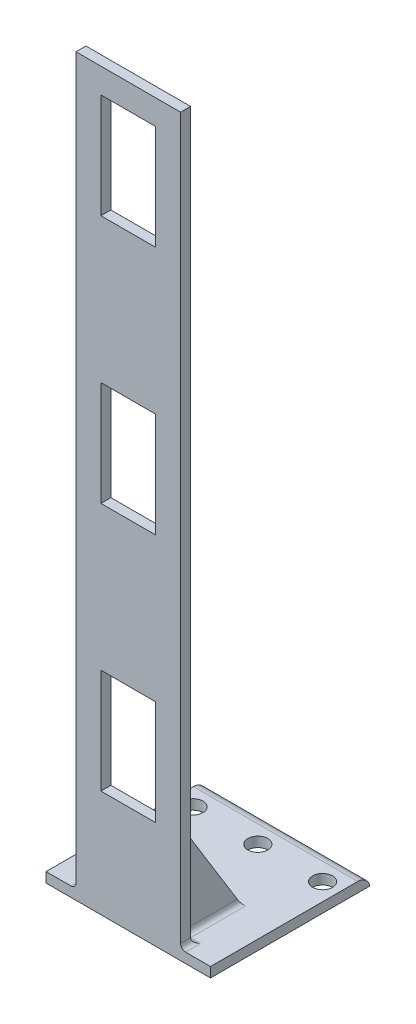
from build123d import *

# Parameters (mm, degrees)
SKETCH1_W                = 21
SKETCH1_H                = 145.5
SKETCH1_W_2              = 11
SKETCH1_H_2              = 21
BOSS_EXTRUDE1_DEPTH      = 2
BOSS_EXTRUDE2_DEPTH      = 30
BOSS_EXTRUDE2_DEPTH_BACK = 2
FILLET2_R                = 2.5
SKETCH6_R                = 2
CUT_EXTRUDE1_DEPTH       = 2
BOSS_EXTRUDE5_DEPTH      = 1
BOSS_EXTRUDE6_DEPTH      = 1
SKETCH9_R                = 2
CUT_EXTRUDE2_DEPTH       = 2
FILLET3_R                = 1


with BuildPart() as part:
    # Sketch1 → Boss-Extrude1 (new body)
    with BuildSketch(Plane.XY):
        Rectangle(SKETCH1_W, SKETCH1_H)
        with Locations((0, -42.75)):
            Rectangle(SKETCH1_W_2, SKETCH1_H_2, mode=Mode.SUBTRACT)
        with Locations((0, 7.25)):
            Rectangle(SKETCH1_W_2, SKETCH1_H_2, mode=Mode.SUBTRACT)
        with Locations((0, 57.25)):
            Rectangle(SKETCH1_W_2, SKETCH1_H_2, mode=Mode.SUBTRACT)
    extrude(amount=BOSS_EXTRUDE1_DEPTH)

    # Sketch2 → Boss-Extrude2 (add, two sides: drawn at the far end of the back side and taken through both)
    with BuildSketch(Plane(origin=(0, 0, 0), x_dir=(-1, 0, 0), z_dir=(0, 0, -1)).offset(-BOSS_EXTRUDE2_DEPTH_BACK)):
        Polygon((10.5, -72.75), (16.5, -72.75), (16.5, -74.75), (-16.5, -74.75), (-16.5, -72.75), align=None)
    extrude(amount=BOSS_EXTRUDE2_DEPTH + BOSS_EXTRUDE2_DEPTH_BACK)

    # Fillet2
    # the kernel refuses this fillet: 2.5 mm, written as the material it takes off along each edge
    with BuildSketch(Plane(origin=(22.623724357, -72.75, -30), x_dir=(0, 0, 1), z_dir=(-1, 0, 0))) as fillet2_piece_1:
        with BuildLine():
            CenterArc((2.449489743, -2.5), FILLET2_R, 90, 78.463040967)
            Line((0, -2), (-0.048989795, -1.99))
            ThreePointArc((-0.048989795, -1.99), (-0.05, -1), (-0.05, 0))
            Line((-0.05, 0), (0, 0.05))
            Line((0, 0.05), (2.449489743, 0.05))
            Line((2.449489743, 0.05), (2.449489743, 0))
        make_face()
    extrude(amount=45.247448714, mode=Mode.SUBTRACT)

    # Sketch6 → Cut-Extrude1 (cut)
    with BuildSketch(Plane(origin=(0, -72.75, 0), x_dir=(1, 0, 0), z_dir=(0, 1, 0))):
        with Locations(Location((0, 24, 0), (0, 0, 270))):
            Circle(SKETCH6_R)
    extrude(amount=-CUT_EXTRUDE1_DEPTH, mode=Mode.SUBTRACT)

    # Sketch7 → Boss-Extrude5 (add, symmetric)
    with BuildSketch(Plane(origin=(7.5, 0, 0), x_dir=(0, 0, -1), z_dir=(1, 0, 0))):
        Polygon((0, -53.25), (12, -72.75), (0, -72.75), align=None)
    extrude(amount=BOSS_EXTRUDE5_DEPTH, both=True)

    # Sketch8 → Boss-Extrude6 (add, symmetric)
    with BuildSketch(Plane(origin=(-7.5, 0, 0), x_dir=(0, 0, -1), z_dir=(1, 0, 0))):
        Polygon((12, -72.75), (0, -53.25), (0, -72.75), align=None)
    extrude(amount=BOSS_EXTRUDE6_DEPTH, both=True)

    # Sketch9 → Cut-Extrude2 (cut)
    with BuildSketch(Plane.XZ.offset(74.75)):
        with Locations(Location((13, -24, 0), (0, 0, 270))):
            Circle(SKETCH9_R)
        with Locations(Location((-13, -24, 0), (0, 0, 90))):
            Circle(SKETCH9_R)
    extrude(amount=-CUT_EXTRUDE2_DEPTH, mode=Mode.SUBTRACT)

    # Fillet3
    fillet3_edges = [part.edges().sort_by_distance(p)[0] for p in [
        (-9.5, -72.75, 0),
        (10.5, -72.75, 1),
        (-10.5, -72.75, 1),
        (9.5, -72.75, 0),
        (6.5, -72.75, -6),
        (8.5, -72.75, -6),
        (0, -72.75, 0),
        (-8.5, -72.75, -6),
        (-6.5, -72.75, -6),
    ]]
    fillet(fillet3_edges, radius=FILLET3_R)


solid = part.part
